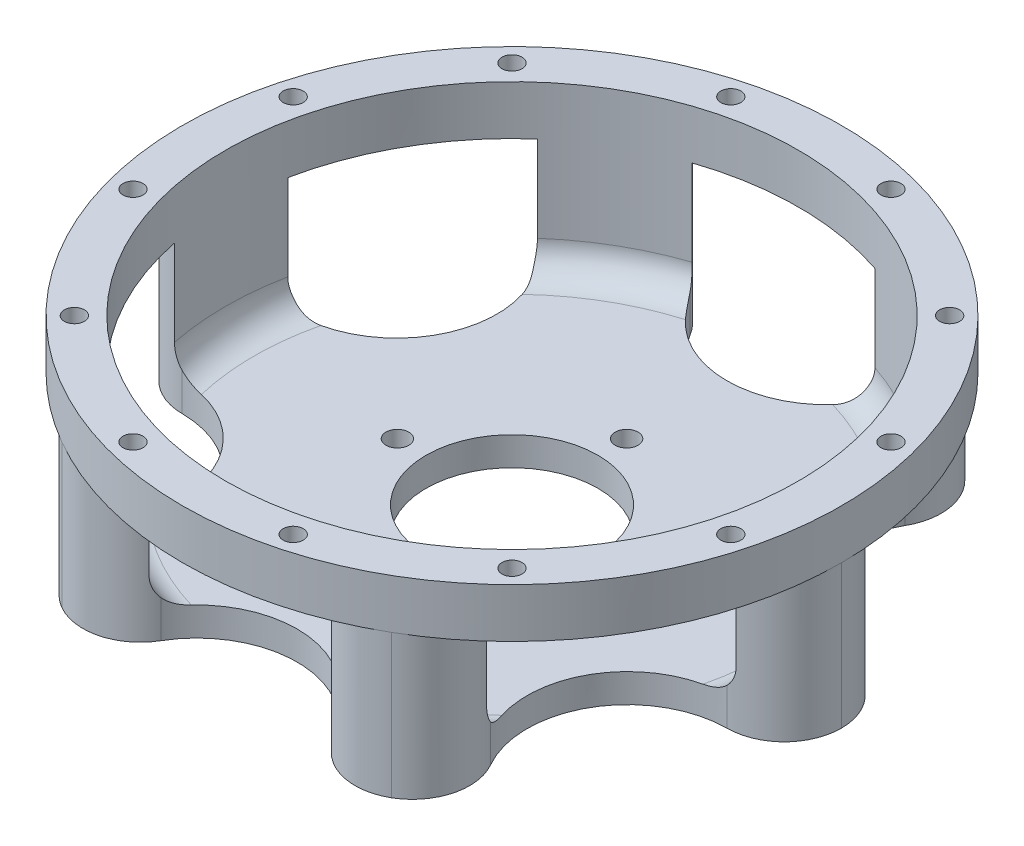
from build123d import *

# Parameters (mm, degrees)
SKETCH1_R           = 57.5
BOSS_EXTRUDE1_DEPTH = 33.6
SKETCH2_R           = 50
CUT_EXTRUDE1_DEPTH  = 28.6
SKETCH7_R           = 1.75
CUT_EXTRUDE4_DEPTH  = 10
FILLET2_R           = 5
SKETCH3_R           = 17.5
CUT_EXTRUDE2_DEPTH  = 25
FILLET1_R           = 10
CIRPATTERN2_DEPTH   = 25
SKETCH5_R           = 2
SKETCH5_R_2         = 15
CUT_EXTRUDE3_DEPTH  = 25
CIRPATTERN3_COUNT   = 6


# Read off the part's stored shape, not the designer's step: CirPattern2
with BuildPart() as part:
    # Sketch1 → Boss-Extrude1 (new body)
    with BuildSketch(Plane(origin=(0, 0, 0), x_dir=(1, 0, 0), z_dir=(0, 1, 0))):
        with Locations(Location((0, 0, 0), (0, 0, 270))):
            Circle(SKETCH1_R)
    extrude(amount=BOSS_EXTRUDE1_DEPTH)

    # Sketch2 → Cut-Extrude1 (cut)
    with BuildSketch(Plane(origin=(0, 33.6, 0), x_dir=(1, 0, 0), z_dir=(0, 1, 0))):
        with Locations(Location((0, 0, 0), (0, 0, 270))):
            Circle(SKETCH2_R)
    extrude(amount=-CUT_EXTRUDE1_DEPTH, mode=Mode.SUBTRACT)

    # Sketch7 → Cut-Extrude4 (cut)
    with BuildSketch(Plane(origin=(0, 33.6, 0), x_dir=(1, 0, 0), z_dir=(0, 1, 0))):
        with Locations(Location((-13.976228436, 52.15999462, 0), (0, 0, 270))):
            Circle(SKETCH7_R)
        with Locations(Location((13.976228436, 52.15999462, 0), (0, 0, 270))):
            Circle(SKETCH7_R)
    cut_extrude4 = extrude(amount=-CUT_EXTRUDE4_DEPTH, mode=Mode.SUBTRACT)

    # Fillet2
    fillet2_edges = [part.edges().sort_by_distance(p)[0] for p in [
        (0, 5, -50),
    ]]
    fillet(fillet2_edges, radius=FILLET2_R)

    # Sketch3 → Cut-Extrude2 (cut)
    with BuildSketch(Plane.XZ):
        with Locations((0, 55)):
            Circle(SKETCH3_R)
    extrude(amount=-CUT_EXTRUDE2_DEPTH, mode=Mode.SUBTRACT)

    # Fillet1
    # the kernel refuses this fillet: 10 mm, written as the material it takes off along each edge
    with BuildSketch(Plane(origin=(-17.498524141, 25, 54.772727273), x_dir=(0.2673887878652172, 0, -0.9635887276862313), z_dir=(0, -1, 0))) as fillet1_piece_1:
        with BuildLine():
            CenterArc((11.468344426, -9.669800453), FILLET1_R, 104.764821464, 89.725856468)
            ThreePointArc((1.78646078, -12.172025276), (0.566760136, -6.133927943), (0, 0))
            ThreePointArc((0, 0), (4.459911721, -0.577849208), (8.919823443, 0))
        make_face()
    extrude(amount=55.756060526, mode=Mode.SUBTRACT)
    with BuildSketch(Plane(origin=(17.498524141, 25, 54.772727273), x_dir=(-0.2673887878652174, 0, -0.9635887276862313), z_dir=(0, -1, 0))) as fillet1_piece_2:
        with BuildLine():
            CenterArc((11.468344426, 9.669800453), FILLET1_R, 165.509322068, 89.725856468)
            ThreePointArc((1.78646078, 12.172025276), (0.566760136, 6.133927943), (0, 0))
            ThreePointArc((0, 0), (4.459911721, 0.577849208), (8.919823443, 0))
        make_face()
    extrude(amount=55.756060526, mode=Mode.SUBTRACT)

    # CirPattern2 outline → CirPattern2 (cut)
    with BuildSketch(Plane(origin=(0, 0, 0), x_dir=(1, 0, 0), z_dir=(0, 1, 0))):
        with BuildLine():
            ThreePointArc((-32.43431744, -36.177486186), (-32.475952642, -18.75), (-47.547780802, -10.000199764))
            ThreePointArc((-47.547780802, -10.000199764), (-54.587917435, -7.054491856), (-57.499999999, -0.000380002))
            ThreePointArc((-57.499999999, -0.000380002), (-49.796460718, -28.75), (-28.750329091, -49.796270715))
            ThreePointArc((-28.750329091, -49.796270715), (-33.403327875, -43.747277311), (-32.43431744, -36.177486186))
        make_face()
        with BuildLine():
            ThreePointArc((-32.43431744, 36.177486186), (-33.403327875, 43.747277311), (-28.750329091, 49.796270715))
            ThreePointArc((-28.750329091, 49.796270715), (-49.796460718, 28.75), (-57.499999999, 0.000380002))
            ThreePointArc((-57.499999999, 0.000380002), (-54.587917435, 7.054491856), (-47.547780802, 10.000199764))
            ThreePointArc((-47.547780802, 10.000199764), (-32.475952642, 18.75), (-32.43431744, 36.177486186))
        make_face()
        with BuildLine():
            ThreePointArc((57.499999999, -0.000380002), (54.587917435, -7.054491856), (47.547780802, -10.000199764))
            ThreePointArc((47.547780802, -10.000199764), (32.475952642, -18.75), (32.43431744, -36.177486186))
            ThreePointArc((32.43431744, -36.177486186), (33.403327875, -43.747277311), (28.750329091, -49.796270715))
            ThreePointArc((28.750329091, -49.796270715), (49.796460718, -28.75), (57.499999999, -0.000380002))
        make_face()
        with BuildLine():
            ThreePointArc((15.113463363, 46.17768595), (21.18458956, 50.801769166), (28.749670908, 49.796650718))
            ThreePointArc((28.749670908, 49.796650718), (0, 57.5), (-28.749670908, 49.796650718))
            ThreePointArc((-28.749670908, 49.796650718), (-21.18458956, 50.801769166), (-15.113463363, 46.17768595))
            ThreePointArc((-15.113463363, 46.17768595), (0, 37.5), (15.113463363, 46.17768595))
        make_face()
        with BuildLine():
            ThreePointArc((28.750329091, 49.796270715), (33.403327875, 43.747277311), (32.43431744, 36.177486186))
            ThreePointArc((32.43431744, 36.177486186), (32.475952642, 18.75), (47.547780802, 10.000199764))
            ThreePointArc((47.547780802, 10.000199764), (54.587917435, 7.054491856), (57.499999999, 0.000380002))
            ThreePointArc((57.499999999, 0.000380002), (49.796460718, 28.75), (28.750329091, 49.796270715))
        make_face()
    extrude(amount=CIRPATTERN2_DEPTH, mode=Mode.SUBTRACT)

    # Sketch5 → Cut-Extrude3 (cut)
    with BuildSketch(Plane.XZ):
        with Locations(Location((0, 20, 0), (0, 0, 270))):
            Circle(SKETCH5_R)
        with Locations(Location((20, 0, 0), (0, 0, 270))):
            Circle(SKETCH5_R)
        with Locations(Location((0, -20, 0), (0, 0, 270))):
            Circle(SKETCH5_R)
        with Locations(Location((-20, 0, 0), (0, 0, 270))):
            Circle(SKETCH5_R)
        with Locations(Location((0, 0, 0), (0, 0, 270))):
            Circle(SKETCH5_R_2)
    extrude(amount=-CUT_EXTRUDE3_DEPTH, mode=Mode.SUBTRACT)

    # CirPattern3: Cut-Extrude4 ×6 about axis
    cirpattern3_axis = Axis((0, 0, 0), (0, 1, 0))
    for i in range(1, CIRPATTERN3_COUNT):
        add(cut_extrude4.rotate(cirpattern3_axis, i * 360 / CIRPATTERN3_COUNT), mode=Mode.SUBTRACT)


solid = part.part
